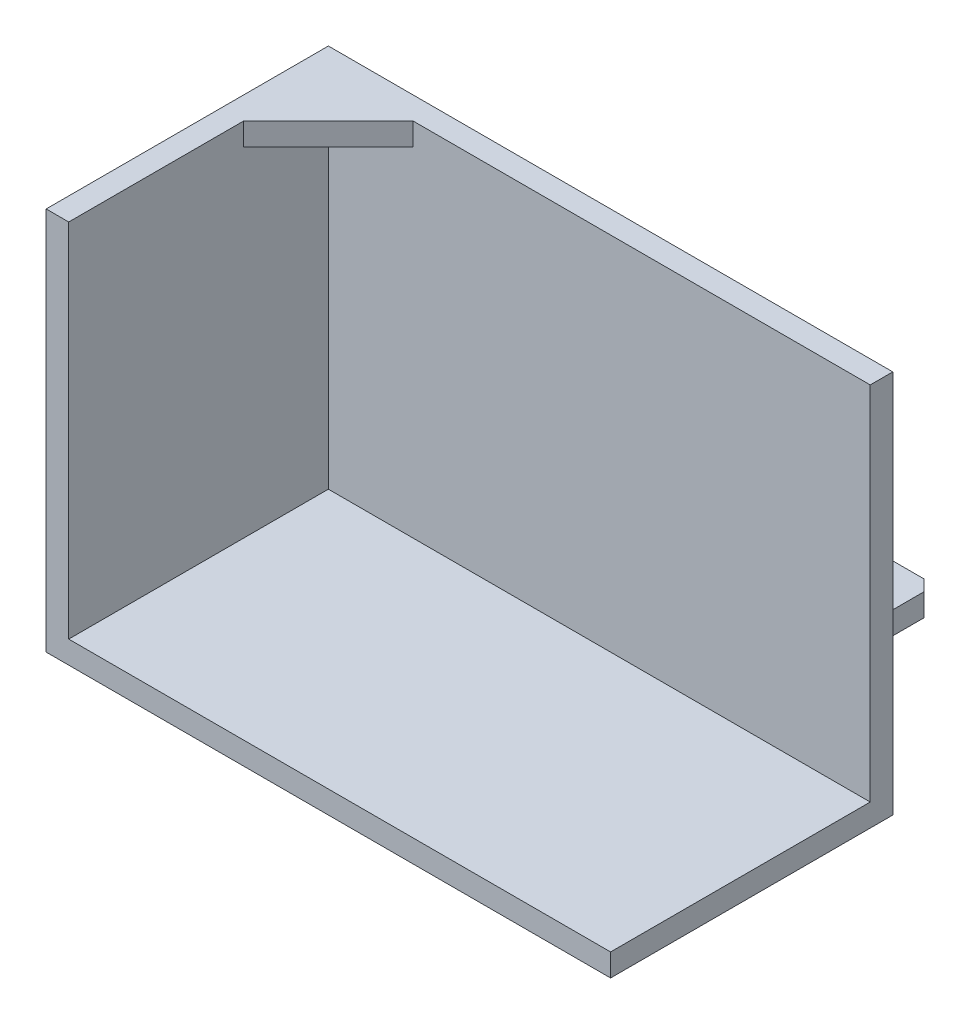
from build123d import *

# Parameters (mm, degrees)
BOSS_EXTRUDE1_DEPTH       = 64
SKETCH2_W                 = 100
SKETCH2_H                 = 50
BOSS_EXTRUDE2_DEPTH       = 4
BOSS_EXTRUDE3_DEPTH       = 4
SKETCH4_W                 = 25
SKETCH4_H                 = 35
BOSS_EXTRUDE4_DEPTH       = 4
F_6_0MM_START             = -4
F_6_0MM_DOWEL_SLOT1_DEPTH = 4
CHAMFER1_SIZE             = 10
CHAMFER2_SIZE             = 2
FILLET1_R                 = 3


# Read off the part's stored shape, not the designer's step: Ø6.0mm Dowel Slot1
with BuildPart() as part:
    # Sketch1 → Boss-Extrude1 (new body)
    with BuildSketch(Plane(origin=(0, 0, 0), x_dir=(1, 0, 0), z_dir=(0, 1, 0))):
        Polygon((0, 0), (0, 4), (-100, 4), (-100, -46), (-96, -46), (-96, 0), align=None)
    extrude(amount=BOSS_EXTRUDE1_DEPTH)

    # Sketch2 → Boss-Extrude2 (add)
    with BuildSketch(Plane.XZ):
        with Locations((-50, 21)):
            Rectangle(SKETCH2_W, SKETCH2_H)
    extrude(amount=BOSS_EXTRUDE2_DEPTH)

    # Sketch3 → Boss-Extrude3 (add)
    with BuildSketch(Plane(origin=(0, 64, 0), x_dir=(1, 0, 0), z_dir=(0, 1, 0))):
        Polygon((-96, 0), (-81, 0), (-96, -15), align=None)
    extrude(amount=-BOSS_EXTRUDE3_DEPTH)

    # Sketch4 → Boss-Extrude4 (add)
    with BuildSketch(Plane.XZ.offset(4)):
        with Locations((-40, -21.5)):
            Rectangle(SKETCH4_W, SKETCH4_H)
    extrude(amount=-BOSS_EXTRUDE4_DEPTH)

    # Ø6.0mm Dowel Slot1 outline → Ø6.0mm Dowel Slot1 (cut)
    with BuildSketch(Plane(origin=(0, 0, 0), x_dir=(1, 0, 0), z_dir=(0, 1, 0)).offset(F_6_0MM_START)):
        with BuildLine():
            Line((-45.25, 10.75), (-34.75, 10.75))
            ThreePointArc((-34.75, 10.75), (-31.5, 14), (-34.75, 17.25))
            Line((-34.75, 17.25), (-45.25, 17.25))
            ThreePointArc((-45.25, 17.25), (-48.5, 14), (-45.25, 10.75))
        make_face()
        with BuildLine():
            Line((-45.25, 25.75), (-34.75, 25.75))
            ThreePointArc((-34.75, 25.75), (-31.5, 29), (-34.75, 32.25))
            Line((-34.75, 32.25), (-45.25, 32.25))
            ThreePointArc((-45.25, 32.25), (-48.5, 29), (-45.25, 25.75))
        make_face()
    extrude(amount=F_6_0MM_DOWEL_SLOT1_DEPTH, mode=Mode.SUBTRACT)

    # Chamfer1
    chamfer1_edges = [part.edges().sort_by_distance(p)[0] for p in [
        (-52.5, -2, -4),
        (-27.5, -2, -4),
    ]]
    chamfer(chamfer1_edges, length=CHAMFER1_SIZE)

    # Chamfer2
    chamfer2_edges = [part.edges().sort_by_distance(p)[0] for p in [
        (-52.5, -2, -39),
        (-27.5, -2, -39),
    ]]
    chamfer(chamfer2_edges, length=CHAMFER2_SIZE)

    # Fillet1
    fillet1_edges = [part.edges().sort_by_distance(p)[0] for p in [
        (-40, 0, -4),
    ]]
    fillet(fillet1_edges, radius=FILLET1_R)


solid = part.part
